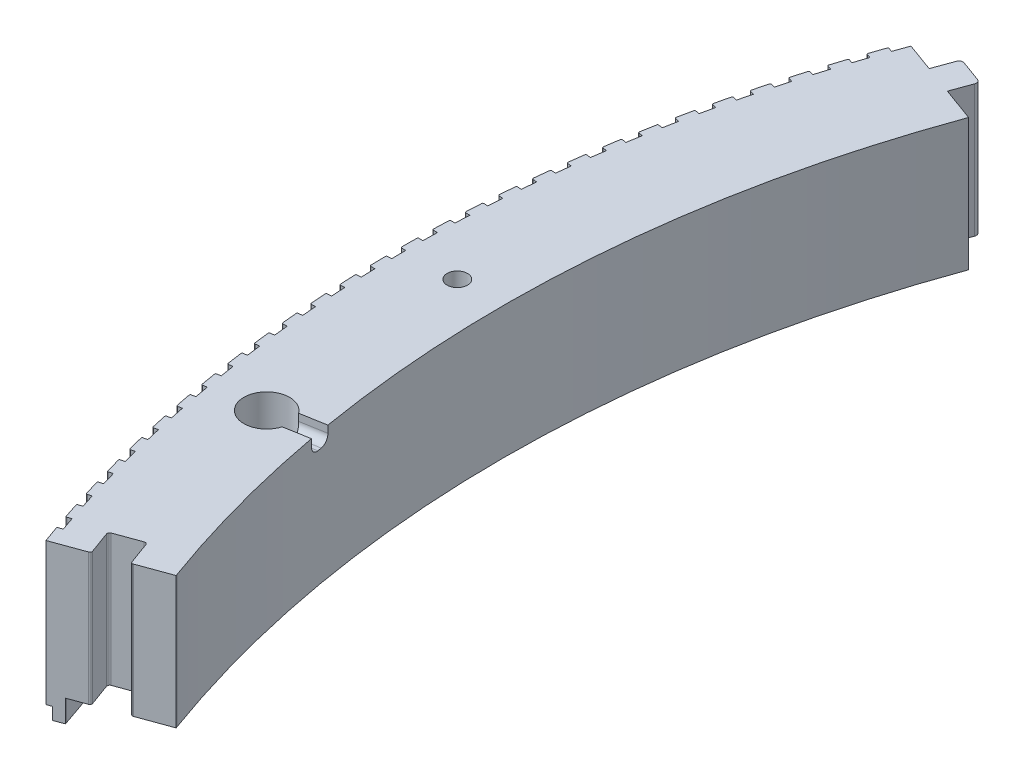
from build123d import *

# Parameters (mm, degrees)
CUT_EXTRUDE4_DEPTH         = 448.090797114
TONGUE_DEPTH               = 33.02
GROOVE_REACH               = 337.962
NOTCH_DEPTH                = 336.961837561
FILLET_NOTCH_R             = 0.254
CIRPATTERN_NOTCHES_START   = -35.56
CIRPATTERN_NOTCHES_DEPTH   = 35.56
CUT_EXTRUDE6_DEPTH         = 38.608
SKETCH4_R                  = 2.1971
HOLES_MOUNTINGBOTTOM_DEPTH = 27.94
SKETCH9_R                  = 2.5527
HOLES_MOUNTINGTOP_DEPTH    = 336.365614775
HEXHOLE_DEPTH              = 25.4
SKETCH13_W                 = 8.8519
SKETCH13_H                 = 33.02
EXTENDLENGTH_DEPTH         = 0.3556
FILLET_GROOVE_R            = 0.508
RELIEF_VERSIONNUMBER_DEPTH = 0.6
SKETCH14_R                 = 2.5527
HOLE_WIRES_DEPTH           = 336.365614807
PCBRELIEF_DEPTH            = 4.318
SKETCH16_R                 = 1.397
HOLES_PCBMOUNTING_DEPTH    = 13.97
REIELF_WIRES_DEPTH         = 7.62
SKETCH18_R                 = 5.715
HOLE_WIRES2_DEPTH          = 13.97
CHAMFER1_SIZE              = 3.81
CUT_EXTRUDE12_DEPTH        = 3.81
FILLET1_R                  = 2.032


# Read off the part's stored shape, not the designer's step: CirPattern-Notches
with BuildPart() as part:
    # Sketch1 → Revolve1 (revolve)
    with BuildSketch(Plane.XY, mode=Mode.PRIVATE) as revolve1_sk:
        Polygon((-289.56, 0), (-314.96, 0), (-314.96, -35.56), (-313.69, -35.56), (-313.69, -38.608), (-311.15, -38.608), (-311.15, -33.02), (-289.56, -33.02), align=None)
    revolve(revolve1_sk.sketch.rotate(Axis((0, 4.1402, 0), (0, -1, 0)), 270), axis=Axis((0, 4.1402, 0), (0, -1, 0)))

    # Sketch3 → Cut-Extrude4 (cut, through all)
    with BuildSketch(Plane(origin=(0, 0, 0), x_dir=(1, 0, 0), z_dir=(0, 1, 0))):
        with BuildLine():
            Line((-340.36, 123.880908935), (0, 0))
            Line((0, 0), (-170.18, -61.940454467))
            Line((-170.18, -61.940454467), (-170.180868731, -61.938067648))
            Line((-170.180868731, -61.938067648), (-340.36, -123.878205923))
            Line((-340.36, -123.878205923), (-340.36, -123.880908935))
            ThreePointArc((-340.36, -123.880908935), (362.20354664, 0), (-340.36, 123.880908935))
        make_face()
    extrude(amount=-CUT_EXTRUDE4_DEPTH, mode=Mode.SUBTRACT)

    # Sketch5 → Tongue (add)
    with BuildSketch(Plane(origin=(0, 0, 0), x_dir=(1, 0, 0), z_dir=(0, 1, 0))):
        with BuildLine():
            Line((-280.451262674, 102.075911776), (-278.626927229, 107.088232215))
            ThreePointArc((-278.626927229, 107.088232215), (-278.66084622, 107.865104834), (-279.234162466, 108.390452383))
            Line((-279.234162466, 108.390452383), (-284.485164831, 110.301660944))
            ThreePointArc((-284.485164831, 110.301660944), (-285.262037451, 110.267741953), (-285.787384999, 109.694425707))
            Line((-285.787384999, 109.694425707), (-287.611720444, 104.682105268))
            Line((-287.611720444, 104.682105268), (-280.451262674, 102.075911776))
        make_face()
    extrude(amount=-TONGUE_DEPTH)

    # Sketch6 → Groove (cut, up to next)
    with BuildSketch(Plane(origin=(0, 0, 0), x_dir=(1, 0, 0), z_dir=(0, 1, 0)), mode=Mode.PRIVATE) as groove_sk1:
        with BuildLine():
            Line((-128.707819823, -518.876197579), (-280.416329106, -102.060493985))
            Line((-280.416329106, -102.060493985), (-282.457847341, -96.451468732))
            ThreePointArc((-282.457847341, -96.451468732), (-282.786189559, -96.093146078), (-283.271734947, -96.071946709))
            Line((-283.271734947, -96.071946709), (-289.310387666, -98.269836554))
            ThreePointArc((-289.310387666, -98.269836554), (-289.66871032, -98.598178772), (-289.689909689, -99.083724159))
            Line((-289.689909689, -99.083724159), (-287.648391454, -104.692749412))
            Line((-287.648391454, -104.692749412), (-135.939882171, -521.508453006))
            Line((-135.939882171, -521.508453006), (167.477136395, -1355.139860195))
            Line((167.477136395, -1355.139860195), (174.709198743, -1352.507604768))
            Line((174.709198743, -1352.507604768), (-128.707819823, -518.876197579))
        make_face()
    groove_tool1 = extrude(groove_sk1.sketch, amount=-GROOVE_REACH, mode=Mode.PRIVATE) & part.part
    add(groove_tool1.solids().sort_by_distance((-57.595102, 0, 725.507875))[0], mode=Mode.SUBTRACT)

    # Sketch7 → Notch (cut, through all)
    with BuildSketch(Plane(origin=(0, 0, 0), x_dir=(1, 0, 0), z_dir=(0, 1, 0))):
        with BuildLine():
            Line((-296.152118835, -103.418270192), (-297.351115267, -103.836967642))
            ThreePointArc((-297.351115267, -103.836967642), (-297.935324969, -102.148635505), (-298.509948564, -100.457016721))
            Line((-298.509948564, -100.457016721), (-297.306279416, -100.051948106))
            ThreePointArc((-297.306279416, -100.051948106), (-296.733972852, -101.736745845), (-296.152118835, -103.418270192))
        make_face()
    extrude(amount=-NOTCH_DEPTH, mode=Mode.SUBTRACT)

    # Fillet-Notch
    fillet_notch_edges = [part.edges().sort_by_distance(p)[0] for p in [
        (-297.351115267, -17.78, 103.836967642),
        (-298.509948564, -17.78, 100.457016721),
    ]]
    fillet(fillet_notch_edges, radius=FILLET_NOTCH_R)

    # CirPattern-Notches outline → CirPattern-Notches (cut)
    with BuildSketch(Plane(origin=(0, 0, 0), x_dir=(1, 0, 0), z_dir=(0, 1, 0)).offset(CIRPATTERN_NOTCHES_START)):
        with BuildLine():
            ThreePointArc((-296.049225252, 103.712450206), (-295.456175483, 105.390058682), (-294.853619373, 107.064276219))
            Line((-294.853619373, 107.064276219), (-295.808923812, 107.411156744))
            ThreePointArc((-295.808923812, 107.411156744), (-295.949150754, 107.535782222), (-295.965587843, 107.722664342))
            ThreePointArc((-295.965587843, 107.722664342), (-296.6548527, 105.809734758), (-297.331753767, 103.892395304))
            ThreePointArc((-297.331753767, 103.892395304), (-297.202186047, 104.037452641), (-297.007992402, 104.048327086))
            Line((-297.007992402, 104.048327086), (-296.049225252, 103.712450206))
        make_face()
        with BuildLine():
            ThreePointArc((-298.54187051, 96.302479991), (-297.990812137, 97.994346681), (-297.430165872, 99.683060391))
            Line((-297.430165872, 99.683060391), (-298.393405254, 100.005887933))
            ThreePointArc((-298.393405254, 100.005887933), (-298.540105496, 100.133592529), (-298.553459144, 100.327631455))
            ThreePointArc((-298.553459144, 100.327631455), (-299.197252673, 98.391084927), (-299.828485072, 96.450407668))
            ThreePointArc((-299.828485072, 96.450407668), (-299.702572525, 96.598648875), (-299.50871019, 96.614359389))
            Line((-299.50871019, 96.614359389), (-298.54187051, 96.302479991))
        make_face()
        with BuildLine():
            ThreePointArc((-300.849079824, 88.832692568), (-300.340355132, 90.537766588), (-299.821966951, 92.239927544))
            Line((-299.821966951, 92.239927544), (-300.792952275, 92.538650205))
            ThreePointArc((-300.792952275, 92.538650205), (-300.942789448, 92.662659264), (-300.960974538, 92.856305146))
            ThreePointArc((-300.960974538, 92.856305146), (-301.556307988, 90.904316251), (-302.138981268, 88.94851094))
            ThreePointArc((-302.138981268, 88.94851094), (-302.016802103, 89.099843939), (-301.823391493, 89.120380764))
            Line((-301.823391493, 89.120380764), (-300.849079824, 88.832692568))
        make_face()
        with BuildLine():
            ThreePointArc((-302.969420098, 81.307727711), (-302.503345075, 83.024949974), (-302.027536968, 84.739500899))
            Line((-302.027536968, 84.739500899), (-303.005665118, 85.013933131))
            ThreePointArc((-303.005665118, 85.013933131), (-303.158546151, 85.134169626), (-303.181551389, 85.327302181))
            ThreePointArc((-303.181551389, 85.327302181), (-303.728054975, 83.361083375), (-304.261807215, 81.391364839))
            ThreePointArc((-304.261807215, 81.391364839), (-304.143437323, 81.545695632), (-303.950598573, 81.57104601))
            Line((-303.950598573, 81.57104601), (-302.969420098, 81.307727711))
        make_face()
        with BuildLine():
            ThreePointArc((-304.901574305, 73.732259469), (-304.478438448, 75.460563341), (-304.045505959, 77.18643926))
            Line((-304.045505959, 77.18643926), (-305.030169382, 77.436410603))
            ThreePointArc((-305.030169382, 77.436410603), (-305.185999315, 77.55279985), (-305.21381041, 77.745299118))
            ThreePointArc((-305.21381041, 77.745299118), (-305.711144678, 75.766071695), (-306.195644344, 73.783663402))
            ThreePointArc((-306.195644344, 73.783663402), (-306.081157248, 73.940896128), (-305.889010138, 73.971044314))
            Line((-305.889010138, 73.971044314), (-304.901574305, 73.732259469))
        make_face()
        with BuildLine():
            ThreePointArc((-306.644342309, 66.110993259), (-306.264408445, 67.849305223), (-305.874620485, 69.585434128))
            Line((-305.874620485, 69.585434128), (-306.865207567, 69.810789314))
            ThreePointArc((-306.865207567, 69.810789314), (-307.023889609, 69.92325902), (-307.056489287, 70.115005431))
            ThreePointArc((-307.056489287, 70.115005431), (-307.504345322, 68.123998767), (-307.939291473, 66.130132068))
            ThreePointArc((-307.939291473, 66.130132068), (-307.828758286, 66.290169063), (-307.637422166, 66.325096331))
            Line((-307.637422166, 66.325096331), (-306.644342309, 66.110993259))
        make_face()
        with BuildLine():
            ThreePointArc((-308.19664161, 58.448662944), (-307.860145731, 60.195903268), (-307.513744412, 61.941206781))
            Line((-307.513744412, 61.941206781), (-308.509639862, 62.141805835))
            ThreePointArc((-308.509639862, 62.141805835), (-308.671075447, 62.250286141), (-308.708443461, 62.441160593))
            ThreePointArc((-308.708443461, 62.441160593), (-309.106543083, 60.439611379), (-309.491665555, 58.435524742))
            ThreePointArc((-309.491665555, 58.435524742), (-309.385154934, 58.598266601), (-309.19474865, 58.637951256))
            Line((-309.19474865, 58.637951256), (-308.19664161, 58.448662944))
        make_face()
        with BuildLine():
            ThreePointArc((-309.557508015, 50.750027897), (-309.26465913, 52.505111301), (-308.961859616, 54.258505347))
            Line((-308.961859616, 54.258505347), (-309.962444844, 54.434223667))
            ThreePointArc((-309.962444844, 54.434223667), (-310.1265337, 54.538647191), (-310.168646837, 54.728531126))
            ThreePointArc((-310.168646837, 54.728531126), (-310.516742771, 52.717682602), (-310.851802352, 50.704620844))
            ThreePointArc((-310.851802352, 50.704620844), (-310.749380454, 50.869966482), (-310.560022274, 50.914383873))
            Line((-310.560022274, 50.914383873), (-309.557508015, 50.750027897))
        make_face()
        with BuildLine():
            ThreePointArc((-310.726096235, 43.019870037), (-310.477076246, 44.781706372), (-310.218066616, 46.54210185))
            Line((-310.218066616, 46.54210185), (-311.222720121, 46.692830291))
            ThreePointArc((-311.222720121, 46.692830291), (-311.389360326, 46.793132171), (-311.436192428, 46.981907644))
            ThreePointArc((-311.436192428, 46.981907644), (-311.734068458, 44.963008826), (-312.018857028, 42.942222337))
            ThreePointArc((-312.018857028, 42.942222337), (-311.920587472, 43.110069052), (-311.732395014, 43.159191591))
            Line((-311.732395014, 43.159191591), (-310.726096235, 43.019870037))
        make_face()
        with BuildLine():
            ThreePointArc((-311.701680417, 35.262990866), (-311.496643998, 37.030485786), (-311.281585135, 38.796789246))
            Line((-311.281585135, 38.796789246), (-312.289682886, 38.922434186))
            ThreePointArc((-312.289682886, 38.922434186), (-312.458770933, 39.018552121), (-312.510292912, 39.206101876))
            ThreePointArc((-312.510292912, 39.206101876), (-312.757764015, 37.180406781), (-312.992104681, 35.15315075))
            ThreePointArc((-312.992104681, 35.15315075), (-312.898048506, 35.323394284), (-312.711138664, 35.377191459))
            Line((-312.711138664, 35.377191459), (-311.701680417, 35.262990866))
        make_face()
        with BuildLine():
            ThreePointArc((-312.483654587, 27.484208483), (-312.322729094, 29.256264129), (-312.151754578, 31.027378451))
            Line((-312.151754578, 31.027378451), (-313.162670408, 31.127861845))
            ThreePointArc((-313.162670408, 31.127861845), (-313.334101269, 31.219736133), (-313.390281122, 31.405943677))
            ThreePointArc((-313.390281122, 31.405943677), (-313.587193585, 29.374710542), (-313.770940789, 27.342244176))
            ThreePointArc((-313.770940789, 27.342244176), (-313.681156416, 27.514778785), (-313.495645288, 27.573217181))
            Line((-313.495645288, 27.573217181), (-312.483654587, 27.484208483))
        make_face()
        with BuildLine():
            ThreePointArc((-313.071533029, 19.688354591), (-312.954818421, 21.46387027), (-312.828034451, 23.238695346))
            Line((-312.828034451, 23.238695346), (-313.84114044, 23.313954782))
            ThreePointArc((-313.84114044, 23.313954782), (-314.014807633, 23.401528356), (-314.075610465, 23.586278026))
            ThreePointArc((-314.075610465, 23.586278026), (-314.221841978, 21.55076853), (-314.354881587, 19.514354273))
            ThreePointArc((-314.354881587, 19.514354273), (-314.269424786, 19.68907279), (-314.085427598, 19.752116107))
            Line((-314.085427598, 19.752116107), (-313.071533029, 19.688354591))
        make_face()
        with BuildLine():
            ThreePointArc((-313.464950591, 11.880271497), (-313.392519362, 13.658144368), (-313.310004689, 15.435577786))
            Line((-313.310004689, 15.435577786), (-314.324671557, 15.485566516))
            ThreePointArc((-314.324671557, 15.485566516), (-314.500467212, 15.568784981), (-314.565855255, 15.751962023))
            ThreePointArc((-314.565855255, 15.751962023), (-314.661314988, 13.713440499), (-314.743564366, 11.674343247))
            ThreePointArc((-314.743564366, 11.674343247), (-314.662488217, 11.851137147), (-314.480119258, 11.918746228))
            Line((-314.480119258, 11.918746228), (-313.464950591, 11.880271497))
        make_face()
        with BuildLine():
            ThreePointArc((-313.663662904, 4.064809106), (-313.635560045, 5.843934862), (-313.597365922, 7.622872589))
            Line((-313.597365922, 7.622872589), (-314.612963421, 7.647559564))
            ThreePointArc((-314.612963421, 7.647559564), (-314.790778343, 7.726371229), (-314.860710983, 7.907861865))
            ThreePointArc((-314.860710983, 7.907861865), (-314.905339641, 5.867594518), (-314.936747701, 3.827080833))
            ThreePointArc((-314.936747701, 3.827080833), (-314.860102563, 4.005840302), (-314.679475109, 4.077973152))
            Line((-314.679475109, 4.077973152), (-313.663662904, 4.064809106))
        make_face()
        with BuildLine():
            ThreePointArc((-313.667546542, -3.753178095), (-313.683789509, -1.973904537), (-313.689939659, -0.194567469))
            Line((-313.689939659, -0.194567469), (-314.705836962, -0.195197584))
            ThreePointArc((-314.705836962, -0.195197584), (-314.885560704, -0.120841672), (-314.959994502, 0.058849827))
            ThreePointArc((-314.959994502, 0.058849827), (-314.953764366, -1.981896054), (-314.934311597, -4.022558729))
            ThreePointArc((-314.934311597, -4.022558729), (-314.862145078, -3.841944725), (-314.683371324, -3.765332911))
            Line((-314.683371324, -3.765332911), (-313.667546542, -3.753178095))
        make_face()
        with BuildLine():
            ThreePointArc((-313.476599092, -11.568834052), (-313.537177795, -9.790517869), (-313.587668399, -8.011886675))
            Line((-313.587668399, -8.011886675), (-314.603234492, -8.037833487))
            ThreePointArc((-314.603234492, -8.037833487), (-314.78475542, -7.967979513), (-314.863644143, -7.790198765))
            ThreePointArc((-314.863644143, -7.790198765), (-314.806559082, -9.830155593), (-314.736257569, -11.869699724))
            ThreePointArc((-314.736257569, -11.869699724), (-314.668614494, -11.687343371), (-314.491805483, -11.60630018))
            Line((-314.491805483, -11.60630018), (-313.476599092, -11.568834052))
        make_face()
        with BuildLine():
            ThreePointArc((-313.090939159, -19.377304157), (-313.19581597, -17.60104993), (-313.290615666, -15.824229386))
            Line((-313.290615666, -15.824229386), (-314.305219742, -15.87547678))
            ThreePointArc((-314.305219742, -15.87547678), (-314.488425107, -15.810168133), (-314.571719754, -15.634408562))
            ThreePointArc((-314.571719754, -15.634408562), (-314.463815225, -17.672309241), (-314.342708635, -19.709467988))
            ThreePointArc((-314.342708635, -19.709467988), (-314.279631019, -19.525482555), (-314.104896575, -19.440058325))
            Line((-314.104896575, -19.440058325), (-313.090939159, -19.377304157))
        make_face()
        with BuildLine():
            ThreePointArc((-312.510806291, -27.173738267), (-312.659916067, -25.400649296), (-312.798965971, -23.626743055))
            Line((-312.798965971, -23.626743055), (-313.81197782, -23.703259198))
            ThreePointArc((-313.81197782, -23.703259198), (-313.996753825, -23.642536444), (-314.084402659, -23.468907221))
            ThreePointArc((-314.084402659, -23.468907221), (-313.925745687, -25.503485932), (-313.753909243, -27.536993936))
            ThreePointArc((-313.753909243, -27.536993936), (-313.695436267, -27.351493704), (-313.522884923, -27.261741495))
            Line((-313.522884923, -27.261741495), (-312.510806291, -27.173738267))
        make_face()
        with BuildLine():
            ThreePointArc((-311.73656083, -34.953293713), (-311.929810955, -33.184471332), (-312.113024697, -31.414581236))
            Line((-312.113024697, -31.414581236), (-313.123815098, -31.516318602))
            ThreePointArc((-313.123815098, -31.516318602), (-313.310046973, -31.460219458), (-313.401995551, -31.288828431))
            ThreePointArc((-313.401995551, -31.288828431), (-313.192684684, -33.318821418), (-312.970225119, -35.347415588))
            ThreePointArc((-312.970225119, -35.347415588), (-312.916393103, -35.160515778), (-312.746132039, -35.06649134))
            Line((-312.746132039, -35.06649134), (-311.73656083, -34.953293713))
        make_face()
        with BuildLine():
            ThreePointArc((-310.768683693, -42.711138311), (-311.005954129, -40.947681204), (-311.233217909, -39.182906601))
            Line((-311.233217909, -39.182906601), (-312.241159021, -39.309801997))
            ThreePointArc((-312.241159021, -39.309801997), (-312.428731089, -39.258361308), (-312.524922299, -39.089314936))
            ThreePointArc((-312.524922299, -39.089314936), (-312.265087547, -41.113461291), (-311.992143042, -43.135881588))
            ThreePointArc((-311.992143042, -43.135881588), (-311.942985422, -42.947698291), (-311.775120392, -42.849460025))
            Line((-311.775120392, -42.849460025), (-310.768683693, -42.711138311))
        make_face()
        with BuildLine():
            ThreePointArc((-309.607776063, -50.442453364), (-309.888919434, -48.685456884), (-310.160092089, -46.926893943))
            Line((-310.160092089, -46.926893943), (-311.164557841, -47.078868548))
            ThreePointArc((-311.164557841, -47.078868548), (-311.353353594, -47.032118267), (-311.453727687, -46.865521549))
            ThreePointArc((-311.453727687, -46.865521549), (-311.143530444, -48.882563997), (-310.820270534, -50.897554219))
            ThreePointArc((-310.820270534, -50.897554219), (-310.775817844, -50.708204322), (-310.610453117, -50.605813248))
            Line((-310.610453117, -50.605813248), (-309.607776063, -50.442453364))
        make_face()
        with BuildLine():
            ThreePointArc((-308.254559026, -58.142436651), (-308.579400702, -56.392992136), (-308.894313797, -54.641733169))
            Line((-308.894313797, -54.641733169), (-309.894680275, -54.818692587))
            ThreePointArc((-309.894680275, -54.818692587), (-310.084582444, -54.776661751), (-310.189077075, -54.612618168))
            ThreePointArc((-310.189077075, -54.612618168), (-309.828710017, -56.621303845), (-309.455335491, -58.627612402))
            ThreePointArc((-309.455335491, -58.627612402), (-309.415615344, -58.437213518), (-309.252853633, -58.330733236))
            Line((-309.252853633, -58.330733236), (-308.254559026, -58.142436651))
        make_face()
        with BuildLine():
            ThreePointArc((-306.709873118, -65.806305413), (-307.078211328, -64.065499511), (-307.436669257, -62.322632293))
            Line((-307.436669257, -62.322632293), (-308.432315096, -62.524466608))
            ThreePointArc((-308.432315096, -62.524466608), (-308.623205726, -62.487181324), (-308.731755988, -62.32579277))
            ThreePointArc((-308.731755988, -62.32579277), (-308.321442953, -64.324874003), (-307.898185729, -66.3212547))
            ThreePointArc((-307.898185729, -66.3212547), (-307.863222795, -66.129925094), (-307.703165198, -66.019421742))
            Line((-307.703165198, -66.019421742), (-306.709873118, -65.806305413))
        make_face()
        with BuildLine():
            ThreePointArc((-304.974677802, -73.429299326), (-305.386283757, -71.698213319), (-305.788063869, -69.964820412))
            Line((-305.788063869, -69.964820412), (-306.778370634, -70.191404256))
            ThreePointArc((-306.778370634, -70.191404256), (-306.970131155, -70.158887684), (-307.082669624, -70.000254403))
            ThreePointArc((-307.082669624, -70.000254403), (-306.622665473, -71.988489486), (-306.149788452, -73.973702292))
            ThreePointArc((-306.149788452, -73.973702292), (-306.119604448, -73.781560806), (-305.962350384, -73.667103022))
            Line((-305.962350384, -73.667103022), (-304.974677802, -73.429299326))
        make_face()
        with BuildLine():
            ThreePointArc((-303.050050877, -81.00668345), (-303.504668912, -79.286392582), (-303.949521645, -77.563550665))
            Line((-303.949521645, -77.563550665), (-304.933874218, -77.814743298))
            ThreePointArc((-304.933874218, -77.814743298), (-305.126385521, -77.787015635), (-305.242842295, -77.631236161))
            ThreePointArc((-305.242842295, -77.631236161), (-304.733432753, -79.607390123), (-304.211229658, -81.580201947))
            ThreePointArc((-304.211229658, -81.580201947), (-304.185843333, -81.387367926), (-304.031490478, -81.269026805))
            Line((-304.031490478, -81.269026805), (-303.050050877, -81.00668345))
        make_face()
        with BuildLine():
            ThreePointArc((-300.937187802, -88.533751179), (-301.434535536, -86.825323991), (-301.922184575, -85.114103186))
            Line((-301.922184575, -85.114103186), (-302.899971537, -85.389748583))
            ThreePointArc((-302.899971537, -85.389748583), (-303.093114045, -85.366827052), (-303.213416788, -85.213998144))
            ThreePointArc((-303.213416788, -85.213998144), (-302.654918271, -87.176843521), (-302.083713462, -89.136028972))
            ThreePointArc((-302.083713462, -89.136028972), (-302.063140584, -88.942622194), (-301.911784812, -88.820471241))
            Line((-301.911784812, -88.820471241), (-300.937187802, -88.533751179))
        make_face()
        with BuildLine():
            ThreePointArc((-298.637400959, -96.005827158), (-299.177169471, -94.310324819), (-299.707311918, -92.611788034))
            Line((-299.707311918, -92.611788034), (-300.677925926, -92.91171498))
            ThreePointArc((-300.677925926, -92.91171498), (-300.871579672, -92.893613819), (-300.995653659, -92.743830406))
            ThreePointArc((-300.995653659, -92.743830406), (-300.388413072, -94.692147997), (-299.768561346, -96.636490149))
            ThreePointArc((-299.768561346, -96.636490149), (-299.752814694, -96.442630747), (-299.604550019, -96.316745835))
            Line((-299.604550019, -96.316745835), (-298.637400959, -96.005827158))
        make_face()
    extrude(amount=CIRPATTERN_NOTCHES_DEPTH, mode=Mode.SUBTRACT)

    # Sketch12 → Cut-Extrude6 (cut)
    with BuildSketch(Plane(origin=(0, 0, 0), x_dir=(1, 0, 0), z_dir=(0, 1, 0))):
        Polygon((-294.853619374, 107.064276219), (-294.772093111, 107.288267785), (-295.965587843, 107.722664342), (-296.128640315, 107.274681356), (-294.934890273, 106.840191873), align=None)
    extrude(amount=-CUT_EXTRUDE6_DEPTH, mode=Mode.SUBTRACT)

    # Sketch4 → Holes_MountingBottom (cut)
    with BuildSketch(Plane(origin=(0, -33.02, 0), x_dir=(1, 0, 0), z_dir=(0, 1, 0))):
        with Locations(Location((-290.73433324, -77.900754654, 0), (0, 0, 270))):
            Circle(SKETCH4_R)
        with Locations(Location((-290.733695665, 77.903134115, 0), (0, 0, 270))):
            Circle(SKETCH4_R)
    extrude(amount=HOLES_MOUNTINGBOTTOM_DEPTH, mode=Mode.SUBTRACT)

    # Sketch9 → Holes_MountingTop (cut, through all)
    with BuildSketch(Plane.XZ.offset(33.02)):
        with Locations(Location((-300.99, 0, 0), (0, 0, 270))):
            Circle(SKETCH9_R)
    extrude(amount=-HOLES_MOUNTINGTOP_DEPTH, mode=Mode.SUBTRACT)

    # Sketch10 → HexHole (cut)
    with BuildSketch(Plane.XZ.offset(33.02)):
        Polygon((-300.99, -5.499261314), (-296.2275, -2.749630657), (-296.2275, 2.749630657), (-300.99, 5.499261314), (-305.7525, 2.749630657), (-305.7525, -2.749630657), align=None)
    extrude(amount=-HEXHOLE_DEPTH, mode=Mode.SUBTRACT)

    # Sketch13 → ExtendLength (add)
    with BuildSketch(Plane(origin=(-0.000868731, 0, -0.002386819), x_dir=(0.9396926207859094, 0, -0.3420201433256661), z_dir=(0.3420201433256661, 0, 0.9396926207859094))):
        Polygon((-306.108099989, -33.02), (-306.108099989, 0), (-314.95999999, 0), (-314.95999999, -35.56), (-313.68999999, -35.56), (-313.68999999, -38.608), (-311.14999999, -38.608), (-311.14999999, -33.02), align=None)
        with Locations((-293.985949989, -16.51)):
            Rectangle(SKETCH13_W, SKETCH13_H)
    extrude(amount=EXTENDLENGTH_DEPTH)

    # Fillet-Groove
    fillet_groove_edges = [part.edges().sort_by_distance(p)[0] for p in [
        (-287.526769091, -16.51, 105.026904108),
        (-280.294706743, -16.51, 102.394648681),
    ]]
    fillet(fillet_groove_edges, radius=FILLET_GROOVE_R)

    # Sketch11 → Relief_VersionNumber (cut)
    with BuildSketch(Plane.XZ.offset(33.02)):
        Polygon((-300.314929004, -43.81152213), (-300.443150158, -42.831546169), (-297.052412979, -41.103613476), (-300.77693221, -40.29663431), (-300.906170992, -39.316658348), (-295.663350479, -40.460472451), (-295.542252722, -41.37939072), align=None)
        with BuildLine():
            Line((-299.874183305, -37.607667272), (-299.754103177, -38.523532656))
            add(Edge.make_bspline(
                [(-299.754103177, -38.523532656), (-299.800275552, -38.522895677), (-299.890784241, -38.521647048), (-300.023295483, -38.507598403), (-300.150523099, -38.487232467), (-300.271128936, -38.454635992), (-300.387320671, -38.417108543), (-300.496200499, -38.367008007), (-300.600933714, -38.310970306), (-300.665313625, -38.265407086), (-300.697444523, -38.242667272)],
                knots=[0, 0, 0, 0, 1.10590767, 2.167838521, 3.190081783, 4.189614044, 5.158639257, 6.111854373, 7.057659211, 8, 8, 8, 8], degree=3))
            add(Edge.make_bspline(
                [(-300.697444523, -38.242667272), (-300.739859376, -38.208860188), (-300.823567065, -38.142140332), (-300.936188846, -38.028987555), (-301.035656352, -37.907116523), (-301.118665776, -37.77427198), (-301.19137458, -37.634367849), (-301.247509954, -37.483772558), (-301.292428914, -37.324584268), (-301.309509391, -37.214083899), (-301.318197729, -37.157875605)],
                knots=[0, 0, 0, 0, 1.012123774, 1.99747347, 2.97483059, 3.943031746, 4.917511136, 5.91389442, 6.938859319, 8, 8, 8, 8], degree=3))
            add(Edge.make_bspline(
                [(-301.318197729, -37.157875605), (-301.323440318, -37.107390674), (-301.33376557, -37.007960883), (-301.334701112, -36.860117492), (-301.322570572, -36.716691873), (-301.29741512, -36.578195327), (-301.258079296, -36.444337619), (-301.206112728, -36.315272443), (-301.141843562, -36.190271116), (-301.064606444, -36.072038732), (-300.977977523, -35.962125831), (-300.884095002, -35.86284789), (-300.784275244, -35.775713653), (-300.677417107, -35.701689534), (-300.564231183, -35.64075512), (-300.445007242, -35.591414507), (-300.31956985, -35.553991351), (-300.232598382, -35.540540829), (-300.188630421, -35.533740989)],
                knots=[0, 0, 0, 0, 1.106798289, 2.179833115, 3.219640885, 4.242912172, 5.245177041, 6.257931994, 7.274006889, 8.306441824, 9.333878846, 10.323192983, 11.283178414, 12.219220722, 13.152949315, 14.08194478, 15.030337423, 16, 16, 16, 16], degree=3))
            add(Edge.make_bspline(
                [(-300.188630421, -35.533740989), (-300.133710601, -35.52858304), (-300.025119303, -35.518384383), (-299.862704306, -35.534053387), (-299.705024359, -35.571930747), (-299.553020511, -35.633673333), (-299.407328388, -35.717194868), (-299.272847387, -35.825483855), (-299.14790274, -35.955112974), (-299.076507045, -36.054466791), (-299.039728177, -36.105648041)],
                knots=[0, 0, 0, 0, 0.974897097, 1.927634547, 2.873111708, 3.837909248, 4.822820657, 5.83591857, 6.88519239, 8, 8, 8, 8], degree=3))
            add(Edge.make_bspline(
                [(-299.039728177, -36.105648041), (-299.032854522, -36.066852172), (-299.019360459, -35.990689805), (-298.989337662, -35.880222533), (-298.952785067, -35.77506297), (-298.909119015, -35.67525205), (-298.858072214, -35.580702287), (-298.798580491, -35.492499782), (-298.733434896, -35.408405339), (-298.661116363, -35.33026444), (-298.583182518, -35.25806276), (-298.499469507, -35.193513409), (-298.409956356, -35.137799545), (-298.31712603, -35.087254892), (-298.218012511, -35.047104303), (-298.115367386, -35.011931888), (-298.007395227, -34.985371909), (-297.93333418, -34.974467102), (-297.895914075, -34.968957336)],
                knots=[0, 0, 0, 0, 1.087259061, 2.134459794, 3.156228952, 4.158413541, 5.138969996, 6.11813924, 7.09223515, 8.073059871, 9.053884592, 10.022246891, 10.986116027, 11.962235451, 12.93615129, 13.934126842, 14.956196351, 16, 16, 16, 16], degree=3))
            add(Edge.make_bspline(
                [(-297.895914075, -34.968957336), (-297.840686689, -34.962928317), (-297.731775252, -34.951038762), (-297.569084538, -34.955556823), (-297.410301682, -34.972751183), (-297.256404185, -35.009341287), (-297.106462683, -35.059737401), (-296.962150016, -35.129438076), (-296.821399653, -35.213724242), (-296.686979403, -35.314586696), (-296.560421721, -35.427117432), (-296.44646989, -35.552289496), (-296.346983184, -35.688127489), (-296.259319409, -35.833399902), (-296.187131462, -35.990299839), (-296.12867703, -36.157383934), (-296.081610769, -36.334515078), (-296.063338909, -36.457176526), (-296.054007023, -36.51982272)],
                knots=[0, 0, 0, 0, 0.990616102, 1.953549332, 2.898398149, 3.836959131, 4.77140935, 5.716665526, 6.691763242, 7.695706411, 8.711972594, 9.710698061, 10.711037512, 11.713134709, 12.734457197, 13.78776723, 14.870158734, 16, 16, 16, 16], degree=3))
            add(Edge.make_bspline(
                [(-296.054007023, -36.51982272), (-296.047611151, -36.579452213), (-296.035098582, -36.696108418), (-296.033048119, -36.869144402), (-296.046292372, -37.035315922), (-296.073472231, -37.195291698), (-296.116481918, -37.348739204), (-296.174484502, -37.495894353), (-296.24838114, -37.635771378), (-296.335854959, -37.768131986), (-296.436601696, -37.891394164), (-296.549806126, -38.00364924), (-296.674948419, -38.103785988), (-296.811179773, -38.19284585), (-296.959312163, -38.270461953), (-297.119644778, -38.335228277), (-297.291285181, -38.388507323), (-297.41061058, -38.413891501), (-297.471563113, -38.426857977)],
                knots=[0, 0, 0, 0, 1.083529125, 2.119763049, 3.122310994, 4.092987562, 5.048028285, 5.997562357, 6.946462798, 7.90213308, 8.860670477, 9.818796009, 10.778234969, 11.752641467, 12.756369817, 13.795863485, 14.874106392, 16, 16, 16, 16], degree=3))
            Line((-297.471563113, -38.426857977), (-297.595713754, -37.484534259))
            add(Edge.make_bspline(
                [(-297.595713754, -37.484534259), (-297.564972984, -37.475277951), (-297.505072403, -37.457241375), (-297.421065634, -37.421216804), (-297.341867398, -37.386190798), (-297.271706172, -37.343234282), (-297.206517336, -37.298841786), (-297.149356262, -37.249216597), (-297.098037105, -37.196508736), (-297.040461593, -37.12090898), (-296.982938305, -37.017472313), (-296.939817513, -36.881609395), (-296.921766343, -36.735111826), (-296.930668058, -36.635476269), (-296.935273049, -36.583933297)],
                knots=[0, 0, 0, 0, 0.935462807, 1.822815969, 2.663731558, 3.457774222, 4.218001464, 4.961632833, 5.661322276, 6.35982171, 7.728152068, 9.08913106, 10.494163743, 12, 12, 12, 12], degree=3))
            add(Edge.make_bspline(
                [(-296.935273049, -36.583933297), (-296.939517539, -36.556695559), (-296.947818644, -36.503425717), (-296.968615047, -36.426508296), (-296.995036394, -36.35391327), (-297.027517742, -36.28562761), (-297.066455746, -36.221602723), (-297.11275275, -36.16306159), (-297.16346806, -36.107154983), (-297.221398499, -36.057997653), (-297.283369743, -36.014612047), (-297.346942392, -35.976647656), (-297.413171869, -35.946671941), (-297.481449453, -35.924320933), (-297.55203862, -35.90906705), (-297.624648018, -35.900597663), (-297.699335156, -35.901044527), (-297.749403784, -35.905809624), (-297.774816318, -35.908228169)],
                knots=[0, 0, 0, 0, 1.099029522, 2.149412222, 3.172594787, 4.177356392, 5.161400937, 6.154798584, 7.150681684, 8.167851019, 9.177793482, 10.166479335, 11.117304349, 12.071589716, 13.027121576, 13.993988955, 14.981840982, 16, 16, 16, 16], degree=3))
            add(Edge.make_bspline(
                [(-297.774816318, -35.908228169), (-297.802779717, -35.912616726), (-297.857798421, -35.921251325), (-297.936832874, -35.946103518), (-298.010552391, -35.980334291), (-298.080977496, -36.021980501), (-298.145273975, -36.074754719), (-298.207731185, -36.133712971), (-298.263013395, -36.203566693), (-298.314137646, -36.280986644), (-298.358976371, -36.366354974), (-298.395464885, -36.459561222), (-298.42429558, -36.559646267), (-298.442788169, -36.667192774), (-298.455239274, -36.781714728), (-298.459237819, -36.903495631), (-298.453561746, -37.032611246), (-298.444844751, -37.120598749), (-298.440345164, -37.16601663)],
                knots=[0, 0, 0, 0, 0.854435879, 1.681124523, 2.492937454, 3.306818372, 4.145618466, 5.000976034, 5.897414847, 6.829871307, 7.801827005, 8.804901216, 9.849583648, 10.943297999, 12.097853743, 13.328521175, 14.62102114, 16, 16, 16, 16], degree=3))
            Line((-298.440345164, -37.16601663), (-299.256482985, -37.27388522))
            add(Edge.make_bspline(
                [(-299.256482985, -37.27388522), (-299.268783472, -37.220824024), (-299.291819362, -37.121453001), (-299.332703877, -36.984626123), (-299.378283989, -36.870829327), (-299.427156295, -36.777166879), (-299.483724135, -36.701944139), (-299.542903795, -36.636510801), (-299.611784401, -36.584656375), (-299.684334511, -36.541722681), (-299.760600674, -36.510606852), (-299.837658912, -36.489060193), (-299.916232442, -36.481982073), (-299.968164855, -36.48617107), (-299.994263434, -36.488276246)],
                knots=[0, 0, 0, 0, 1.63800959, 3.067603054, 4.289516368, 5.321105224, 6.233178835, 7.113727007, 7.964641627, 8.815005671, 9.642920853, 10.434790159, 11.213405486, 12, 12, 12, 12], degree=3))
            add(Edge.make_bspline(
                [(-299.994263434, -36.488276246), (-300.026822354, -36.494510831), (-300.090028242, -36.506613889), (-300.1784033, -36.54525755), (-300.254281172, -36.602231534), (-300.317744564, -36.674335606), (-300.36734668, -36.758621441), (-300.396228984, -36.854433809), (-300.409351499, -36.958576701), (-300.402735589, -37.029996976), (-300.399279459, -37.067306695)],
                knots=[0, 0, 0, 0, 1.002412102, 1.945959741, 2.89375359, 3.854998276, 4.840613737, 5.832214989, 6.867556192, 8, 8, 8, 8], degree=3))
            add(Edge.make_bspline(
                [(-300.399279459, -37.067306695), (-300.393237903, -37.100491298), (-300.381318, -37.165964034), (-300.344506555, -37.259197543), (-300.293083927, -37.345243449), (-300.227901664, -37.423589331), (-300.151240517, -37.491059685), (-300.066097446, -37.545964252), (-299.972932361, -37.585356812), (-299.90737317, -37.600168657), (-299.874183305, -37.607667272)],
                knots=[0, 0, 0, 0, 1.003318872, 1.979533445, 2.967765499, 3.979957863, 5.004194586, 5.999742017, 6.987353387, 8, 8, 8, 8], degree=3))
        make_face()
    extrude(amount=-RELIEF_VERSIONNUMBER_DEPTH, mode=Mode.SUBTRACT)

    # Sketch14 → Hole-Wires (cut, through all)
    with BuildSketch(Plane.XZ.offset(33.02)):
        with Locations(Location((-296.417514815, 52.26506492, 0), (0, 0, 270))):
            Circle(SKETCH14_R)
    extrude(amount=-HOLE_WIRES_DEPTH, mode=Mode.SUBTRACT)

    # Sketch15 → PCBRelief (cut)
    with BuildSketch(Plane.XZ.offset(33.02)):
        Polygon((-301.108488433, 64.369219517), (-305.79397288, 36.052245111), (-292.7631528, 33.896092976), (-288.077668352, 62.213067382), align=None)
    extrude(amount=-PCBRELIEF_DEPTH, mode=Mode.SUBTRACT)

    # Sketch16 → Holes-PCBMounting (cut)
    with BuildSketch(Plane.XZ.offset(28.702)):
        with Locations(Location((-295.277242051, 59.156364001, 0), (0, 0, 270))):
            Circle(SKETCH16_R)
        with Locations(Location((-298.594399182, 39.108948492, 0), (0, 0, 270))):
            Circle(SKETCH16_R)
    extrude(amount=-HOLES_PCBMOUNTING_DEPTH, mode=Mode.SUBTRACT)

    # Sketch17 → Reielf-Wires (cut)
    with BuildSketch(Plane.XZ.offset(28.702)):
        Polygon((-302.483035419, 56.062071716), (-304.419425894, 44.359392913), (-291.408926447, 42.080431948), (-289.472535972, 53.783110751), align=None)
    extrude(amount=-REIELF_WIRES_DEPTH, mode=Mode.SUBTRACT)

    # Sketch18 → Hole-Wires2 (cut)
    with BuildSketch(Plane(origin=(0, 0, 0), x_dir=(1, 0, 0), z_dir=(0, 1, 0))):
        with Locations(Location((-296.417514815, -52.26506492, 0), (0, 0, 270))):
            Circle(SKETCH18_R)
    extrude(amount=-HOLE_WIRES2_DEPTH, mode=Mode.SUBTRACT)

    # Chamfer1
    # the kernel refuses this chamfer: 3.81 mm, written as the material it adds along each edge
    with BuildSketch(Plane(origin=(-296.417514815, -13.97, 52.26506492), x_dir=(0, 0, 1), z_dir=(-1, 0, 0))) as chamfer1_piece_1_section:
        Polygon((5.715, CHAMFER1_SIZE), (5.715 - CHAMFER1_SIZE, 0), (5.715, 0), align=None)
    chamfer1_piece_1 = revolve(axis=Axis((-296.417514815, -13.97, 52.26506492), (0, 1, 0)), mode=Mode.PRIVATE)
    chamfer1_piece_1 = chamfer1_piece_1 - Plane(origin=(-296.417514815, -11.729899796, 52.26506492), x_dir=(0, 0, -1), z_dir=(0, -1, 0)) * Cylinder(2.5527, 23, mode=Mode.PRIVATE)
    add(chamfer1_piece_1)

    # Sketch19 → Cut-Extrude12 (cut)
    with BuildSketch(Plane(origin=(0, 0, 0), x_dir=(1, 0, 0), z_dir=(0, 1, 0))):
        Polygon((-296.417514815, -52.26506492), (-296.858570215, -49.763651293), (-283.100795266, -47.337846592), (-282.659739866, -49.839260219), (-282.218684465, -52.340673846), (-295.976459415, -54.766478547), align=None)
    extrude(amount=-CUT_EXTRUDE12_DEPTH, mode=Mode.SUBTRACT)

    # Fillet1
    fillet1_edges = [part.edges().sort_by_distance(p)[0] for p in [
        (-288.704023718, -3.81, 48.325821607),
        (-287.821912917, -3.81, 53.328648861),
    ]]
    fillet(fillet1_edges, radius=FILLET1_R)


solid = part.part
